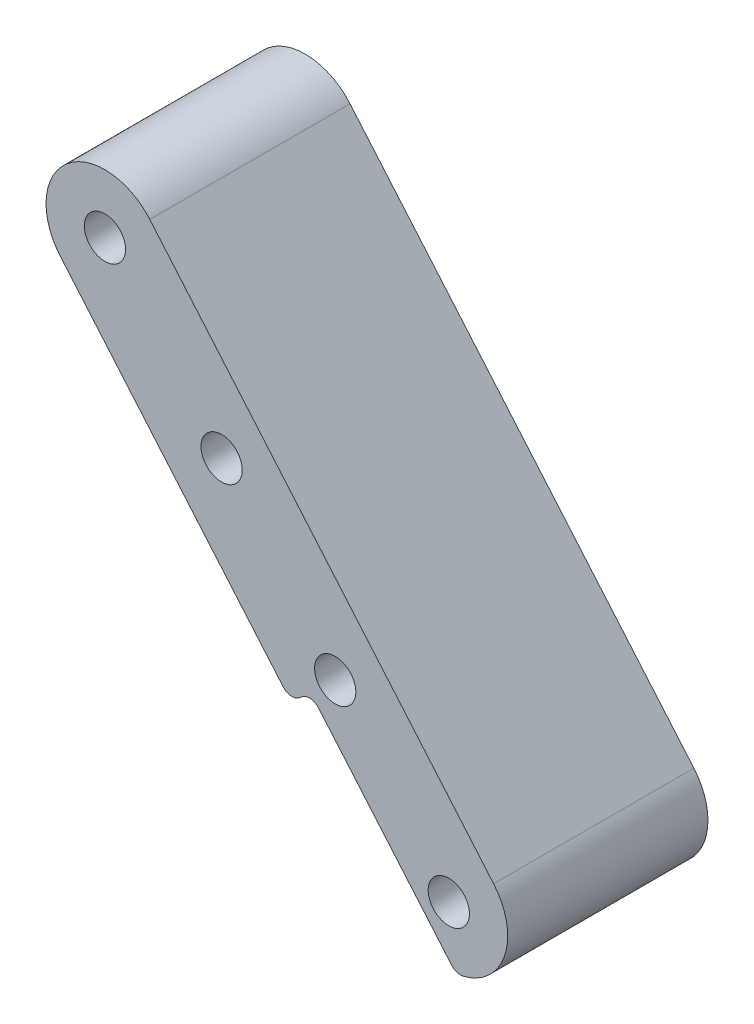
from build123d import *

# Parameters (mm, degrees)
SKETCH_1_R          = 3.5
SKETCH_1_R_2        = 3.500000001
EXTRUDE_3_DEPTH     = 34
CUT_EXTRUDE_1_DEPTH = 164.659924305
FILLET_1_R          = 2


with BuildPart() as part:
    # 草图1 → 凸台-拉伸3 (new body)
    with BuildSketch(Plane.XY):
        with BuildLine():
            Line((99.709351413, -106.819410926), (41.331697392, -38.327914958))
            ThreePointArc((41.331697392, -38.327914958), (27.234285836, -37.204087831), (26.110458709, -51.301499387))
            Line((26.110458709, -51.301499387), (84.48811273, -119.792995355))
            ThreePointArc((84.48811273, -119.792995355), (98.585524286, -120.916822482), (99.709351413, -106.819410926))
        make_face()
        with Locations((53.53147549, -67.343536554)):
            Circle(SKETCH_1_R, mode=Mode.SUBTRACT)
        with Locations((33.721078051, -44.814707172)):
            Circle(SKETCH_1_R, mode=Mode.SUBTRACT)
        with Locations((72.815103781, -90.324869847)):
            Circle(SKETCH_1_R, mode=Mode.SUBTRACT)
        with Locations((92.098732072, -113.306203141)):
            Circle(SKETCH_1_R_2, mode=Mode.SUBTRACT)
    extrude(amount=EXTRUDE_3_DEPTH)

    # 草图2 → 切除-拉伸1 (cut, through all)
    with BuildSketch(Plane.XY.offset(34)):
        with BuildLine():
            ThreePointArc((84.48811273, -119.792995355), (88.47574874, -122.626824996), (93.330431012, -123.230059131))
            Line((93.330431012, -123.230059131), (68.680620596, -94.309705633))
            Line((68.680620596, -94.309705633), (65.255841892, -97.228762129))
            Line((65.255841892, -97.228762129), (84.48811273, -119.792995355))
        make_face()
    extrude(amount=-CUT_EXTRUDE_1_DEPTH, mode=Mode.SUBTRACT)

    # 圆角1
    fillet_1_edges = [part.edges().sort_by_distance(p)[0] for p in [
        (65.255841892, -97.228762129, 17),
        (93.330431012, -123.230059131, 17),
        (68.680620596, -94.309705633, 17),
    ]]
    fillet(fillet_1_edges, radius=FILLET_1_R)


solid = part.part
